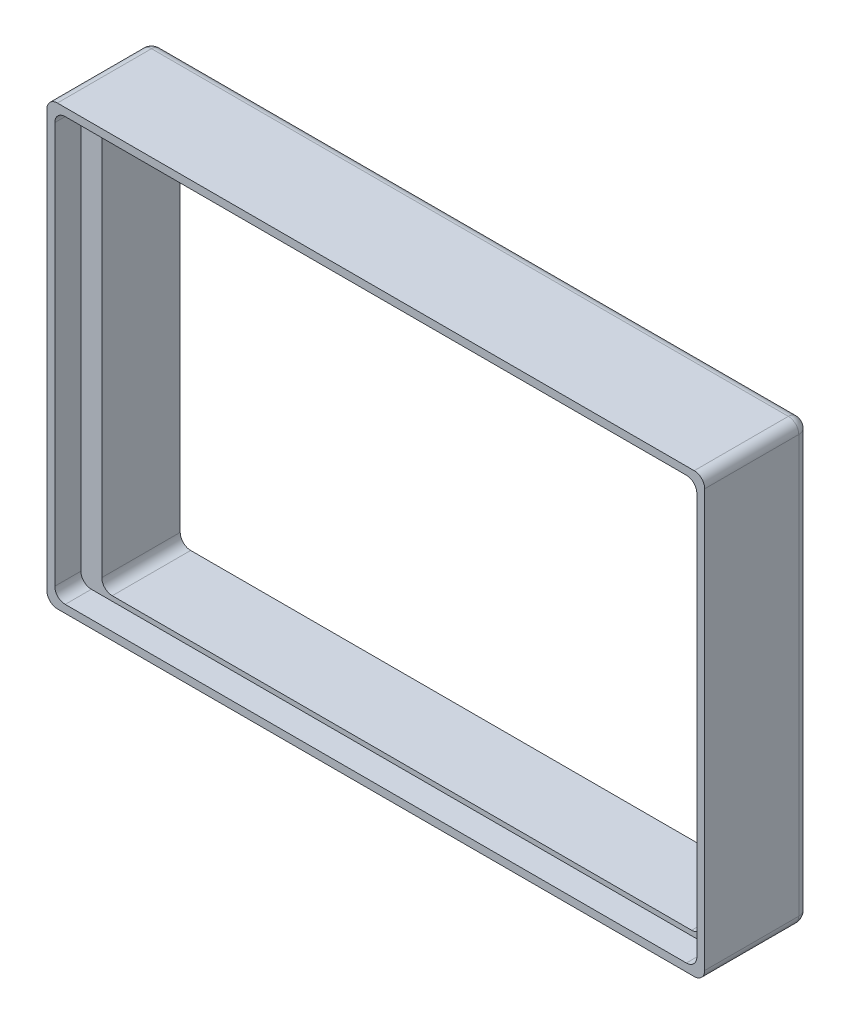
from build123d import *

# Parameters (mm, degrees)
SKETCH_3_W          = 125.81
SKETCH_3_H          = 83.8
EXTRUDE_2_DEPTH     = 20
SKETCH_5_W          = 122.81
SKETCH_5_H          = 80.8
CUT_EXTRUDE_1_DEPTH = 5
SKETCH_6_W          = 114.82
SKETCH_6_H          = 78.94
CUT_EXTRUDE_2_DEPTH = 15
FILLET_1_R          = 2
FILLET_2_R          = 2
FILLET_3_R          = 2


with BuildPart() as part:
    # 草图3 → 凸台-拉伸2 (new body)
    with BuildSketch(Plane.XY):
        Rectangle(SKETCH_3_W, SKETCH_3_H)
    extrude(amount=EXTRUDE_2_DEPTH)

    # 草图5 → 切除-拉伸1 (cut)
    with BuildSketch(Plane.XY.offset(20)):
        Rectangle(SKETCH_5_W, SKETCH_5_H)
    extrude(amount=-CUT_EXTRUDE_1_DEPTH, mode=Mode.SUBTRACT)

    # 草图6 → 切除-拉伸2 (cut)
    with BuildSketch(Plane(origin=(0, 0, 0), x_dir=(-1, 0, 0), z_dir=(0, 0, -1))):
        Rectangle(SKETCH_6_W, SKETCH_6_H)
    extrude(amount=-CUT_EXTRUDE_2_DEPTH, mode=Mode.SUBTRACT)

    # 圆角1
    fillet_1_edges = [part.edges().sort_by_distance(p)[0] for p in [
        (0, -41.9, 0),
        (-62.905, 0, 0),
        (0, 41.9, 0),
        (62.905, 0, 0),
    ]]
    fillet(fillet_1_edges, radius=FILLET_1_R)

    # 圆角2
    # the kernel refuses this fillet: 2 mm, written as the material it takes off along each edge
    with BuildSketch(Plane(origin=(60.905, -39.9, 2), x_dir=(0, -1, 0), z_dir=(1, 0, 0))) as fillet_2_piece_1_section:
        Polygon((0, 0), (FILLET_2_R, 0), (FILLET_2_R, FILLET_2_R), (0, FILLET_2_R), align=None)
    fillet_2_piece_1 = extrude(amount=FILLET_2_R, mode=Mode.PRIVATE)
    fillet_2_piece_1 = fillet_2_piece_1 - Plane(origin=(60.905, -39.9, 2), x_dir=(0, 0.7071067811865475, 0.7071067811865475), z_dir=(1, 0, 0)) * Sphere(FILLET_2_R, mode=Mode.PRIVATE)
    add(fillet_2_piece_1, mode=Mode.SUBTRACT)
    with BuildSketch(Plane(origin=(-60.905, -39.9, 2), x_dir=(0, -1, 0), z_dir=(-1, 0, 0))) as fillet_2_piece_2_section:
        Polygon((0, 0), (FILLET_2_R, 0), (FILLET_2_R, -FILLET_2_R), (0, -FILLET_2_R), align=None)
    fillet_2_piece_2 = extrude(amount=FILLET_2_R, mode=Mode.PRIVATE)
    fillet_2_piece_2 = fillet_2_piece_2 - Plane(origin=(-60.905, -39.9, 2), x_dir=(0, 0.7071067811865475, 0.7071067811865475), z_dir=(-1, 0, 0)) * Sphere(FILLET_2_R, mode=Mode.PRIVATE)
    add(fillet_2_piece_2, mode=Mode.SUBTRACT)
    with BuildSketch(Plane(origin=(60.905, 39.9, 2), x_dir=(1, 0, 0), z_dir=(0, 1, 0))) as fillet_2_piece_3_section:
        Polygon((0, 0), (FILLET_2_R, 0), (FILLET_2_R, FILLET_2_R), (0, FILLET_2_R), align=None)
    fillet_2_piece_3 = extrude(amount=FILLET_2_R, mode=Mode.PRIVATE)
    fillet_2_piece_3 = fillet_2_piece_3 - Plane(origin=(60.905, 39.9, 2), x_dir=(-0.7071067811865475, 0, 0.7071067811865475), z_dir=(0, 1, 0)) * Sphere(FILLET_2_R, mode=Mode.PRIVATE)
    add(fillet_2_piece_3, mode=Mode.SUBTRACT)
    with BuildSketch(Plane(origin=(-60.905, 39.9, 2), x_dir=(-1, 0, 0), z_dir=(0, 1, 0))) as fillet_2_piece_4_section:
        Polygon((0, 0), (FILLET_2_R, 0), (FILLET_2_R, -FILLET_2_R), (0, -FILLET_2_R), align=None)
    fillet_2_piece_4 = extrude(amount=FILLET_2_R, mode=Mode.PRIVATE)
    fillet_2_piece_4 = fillet_2_piece_4 - Plane(origin=(-60.905, 39.9, 2), x_dir=(0.7071067811865475, 0, 0.7071067811865475), z_dir=(0, 1, 0)) * Sphere(FILLET_2_R, mode=Mode.PRIVATE)
    add(fillet_2_piece_4, mode=Mode.SUBTRACT)
    with BuildSketch(Plane(origin=(62.905, -41.9, 2), x_dir=(0, 1, 0), z_dir=(0, 0, 1)), Plane(origin=(62.905, 41.9, 2), x_dir=(-1, 0, 0), z_dir=(0, 0, 1))) as fillet_2_piece_5:
        with BuildLine():
            CenterArc((FILLET_2_R, FILLET_2_R), FILLET_2_R, 180, 90)
            Line((0, FILLET_2_R), (0, 0))
            Line((0, 0), (FILLET_2_R, 0))
        make_face()
    extrude(amount=23, mode=Mode.SUBTRACT)
    with BuildSketch(Plane(origin=(-62.905, -41.9, 2), x_dir=(0, 1, 0), z_dir=(0, 0, 1)), Plane(origin=(-62.905, 41.9, 2), x_dir=(1, 0, 0), z_dir=(0, 0, 1))) as fillet_2_piece_6:
        with BuildLine():
            CenterArc((FILLET_2_R, -FILLET_2_R), FILLET_2_R, 90, 90)
            Line((0, -FILLET_2_R), (0, 0))
            Line((0, 0), (FILLET_2_R, 0))
        make_face()
    extrude(amount=23, mode=Mode.SUBTRACT)

    # 圆角3
    fillet_3_edges = [part.edges().sort_by_distance(p)[0] for p in [
        (61.405, 40.4, 17.5),
        (61.405, -40.4, 17.5),
        (-61.405, -40.4, 17.5),
        (-61.405, 40.4, 17.5),
        (-57.41, 39.47, 7.5),
        (-57.41, -39.47, 7.5),
        (57.41, -39.47, 7.5),
        (57.41, 39.47, 7.5),
    ]]
    fillet(fillet_3_edges, radius=FILLET_3_R)


solid = part.part
